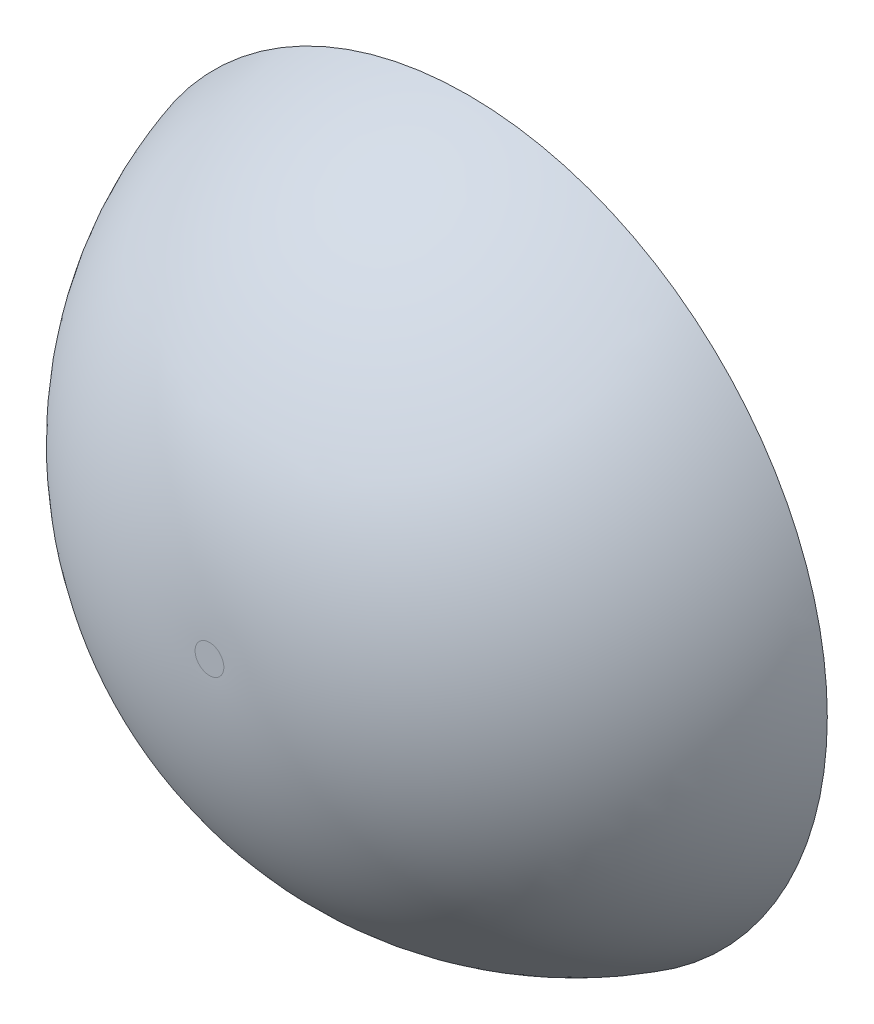
from build123d import *

# Parameters (mm, degrees)
ESQUISSE1_R                  = 25
BOSS_EXTRU_1_DEPTH           = 18
CONG_1_R                     = 25
R_P_TITION_CIRCULAIRE1_COUNT = 3


with BuildPart() as part:
    # Esquisse1 → Boss.-Extru.1 (new body)
    with BuildSketch(Plane.XY):
        Circle(ESQUISSE1_R)
    extrude(amount=BOSS_EXTRU_1_DEPTH)

    # Congé1
    # the kernel refuses this fillet: 25 mm, written as the material it takes off along each edge
    with BuildSketch(Plane(origin=(0, 0, 18), x_dir=(1, 0, 0), z_dir=(0, -1, 0))) as cong_1_piece_1:
        with BuildLine():
            CenterArc((1, -25), CONG_1_R, 16.260204708, 73.739795292)
            Line((1, 0), (1, 0.5))
            Line((1, 0.5), (25, 0.5))
            Line((25, 0.5), (25.5, 0))
            ThreePointArc((25.5, 0), (25.5, -9), (25.48, -17.86))
            Line((25.48, -17.86), (25, -18))
        make_face()
    revolve(axis=Axis((0, 0, 18), (0, 0, 1)), mode=Mode.SUBTRACT)

    # Esquisse3 → Enlèvement de matière-Révolution1 (revolve, cut)
    with BuildSketch(Plane(origin=(0, 0, 0), x_dir=(1, 0, 0), z_dir=(0, 1, 0))):
        Polygon((16.821135137, 2.685962281), (3.656768508, -9.5900082), (5.123064982, -11.162418658), (18.287431611, 1.113551823), align=None)
    enl_vement_de_mati_re_r_volution1 = revolve(axis=Axis((0, 0, 13), (0.7313537016191742, 0, -0.6819983600624946)), mode=Mode.SUBTRACT)

    # Répétition circulaire1: Enlèvement de matière-Révolution1 ×3 about axis
    r_p_tition_circulaire1_axis = Axis((0, 0, 0), (0, 0, 1))
    for i in range(1, R_P_TITION_CIRCULAIRE1_COUNT):
        add(enl_vement_de_mati_re_r_volution1.rotate(r_p_tition_circulaire1_axis, i * 360 / R_P_TITION_CIRCULAIRE1_COUNT), mode=Mode.SUBTRACT)


solid = part.part
